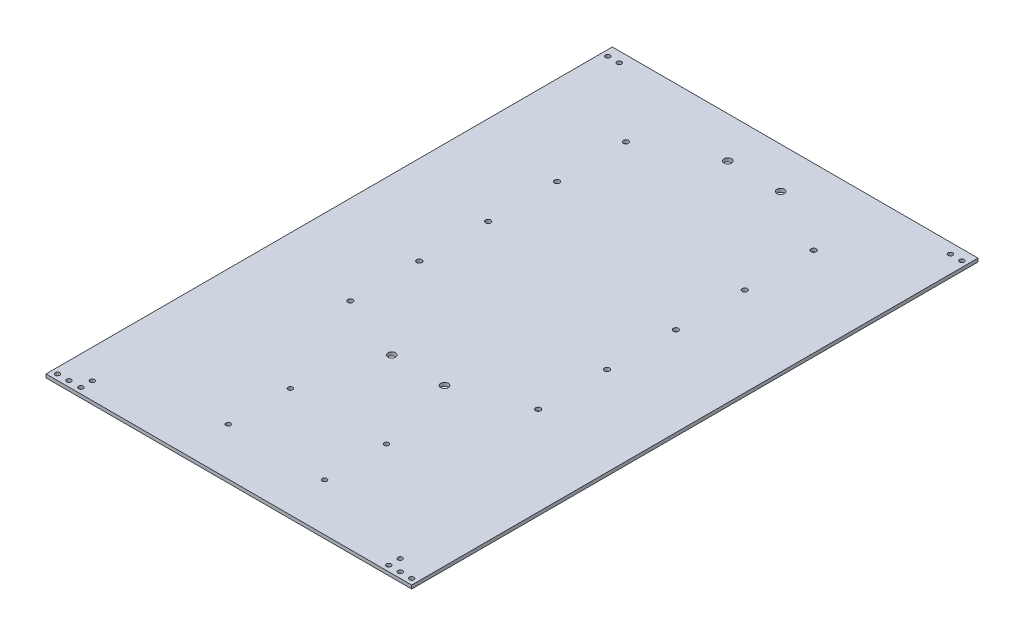
from build123d import *

# Parameters (mm, degrees)
SKETCH_1_W               = 318.56
SKETCH_1_H               = 493.33
SKETCH_1_R               = 2.25
SKETCH_1_R_2             = 2
EXTRUDE_1_DEPTH          = 3
CUT_EXTRUDE_1_DEPTH      = 294.637090002
CUT_EXTRUDE_1_DEPTH_BACK = 294.637090002
SKETCH_2_R               = 2
SKETCH_2_R_2             = 3.3


with BuildPart() as part:
    # 草图1 → 凸台-拉伸1 (new body)
    with BuildSketch(Plane(origin=(0, 0, 0), x_dir=(1, 0, 0), z_dir=(0, 1, 0))):
        Rectangle(SKETCH_1_W, SKETCH_1_H)
        with Locations((81.78, 181.012789491)):
            Circle(SKETCH_1_R, mode=Mode.SUBTRACT)
        with Locations((81.78, 121.012789491)):
            Circle(SKETCH_1_R, mode=Mode.SUBTRACT)
        with Locations((81.78, 61.012789491)):
            Circle(SKETCH_1_R, mode=Mode.SUBTRACT)
        with Locations((81.78, -58.987210509)):
            Circle(SKETCH_1_R, mode=Mode.SUBTRACT)
        with Locations((81.78, 1.012789491)):
            Circle(SKETCH_1_R, mode=Mode.SUBTRACT)
        with Locations((-81.78, -58.987210509)):
            Circle(SKETCH_1_R, mode=Mode.SUBTRACT)
        with Locations((-81.78, 1.012789491)):
            Circle(SKETCH_1_R, mode=Mode.SUBTRACT)
        with Locations((-81.78, 61.012789491)):
            Circle(SKETCH_1_R, mode=Mode.SUBTRACT)
        with Locations((-81.78, 121.012789491)):
            Circle(SKETCH_1_R, mode=Mode.SUBTRACT)
        with Locations((-81.78, 181.012789491)):
            Circle(SKETCH_1_R, mode=Mode.SUBTRACT)
        with Locations((-154.28, 237.665)):
            Circle(SKETCH_1_R_2, mode=Mode.SUBTRACT)
        with Locations((-144.28, 237.665)):
            Circle(SKETCH_1_R_2, mode=Mode.SUBTRACT)
        with Locations((144.28, 237.665)):
            Circle(SKETCH_1_R_2, mode=Mode.SUBTRACT)
        with Locations((154.28, 237.665)):
            Circle(SKETCH_1_R_2, mode=Mode.SUBTRACT)
        with Locations((134.28, -231.665)):
            Circle(SKETCH_1_R_2, mode=Mode.SUBTRACT)
        with Locations((134.28, -241.665)):
            Circle(SKETCH_1_R_2, mode=Mode.SUBTRACT)
        with Locations((144.28, -241.665)):
            Circle(SKETCH_1_R_2, mode=Mode.SUBTRACT)
        with Locations((154.28, -241.665)):
            Circle(SKETCH_1_R_2, mode=Mode.SUBTRACT)
        with Locations((-133.885842783, -231.665)):
            Circle(SKETCH_1_R_2, mode=Mode.SUBTRACT)
        with Locations((-133.885842783, -241.665)):
            Circle(SKETCH_1_R_2, mode=Mode.SUBTRACT)
        with Locations((-144.28, -241.665)):
            Circle(SKETCH_1_R_2, mode=Mode.SUBTRACT)
        with Locations((-154.28, -241.665)):
            Circle(SKETCH_1_R_2, mode=Mode.SUBTRACT)
    extrude(amount=EXTRUDE_1_DEPTH)

    # 草图2 → 切除-拉伸1 (cut, two sides: drawn at the far end of the back side and taken through both)
    with BuildSketch(Plane.XZ.offset(-CUT_EXTRUDE_1_DEPTH_BACK)):
        with Locations((41.9, 205.217949373)):
            Circle(SKETCH_2_R)
        with Locations((-41.9, 151.217949373)):
            Circle(SKETCH_2_R)
        with Locations((41.9, 151.217949373)):
            Circle(SKETCH_2_R)
        with Locations((-41.9, 205.217949373)):
            Circle(SKETCH_2_R)
        with Locations((-23, -211.012789491)):
            Circle(SKETCH_2_R_2)
        with Locations((23, -211.012789491)):
            Circle(SKETCH_2_R_2)
        with Locations((-23, 81.776091935)):
            Circle(SKETCH_2_R_2)
        with Locations((23, 81.776091935)):
            Circle(SKETCH_2_R_2)
    extrude(amount=CUT_EXTRUDE_1_DEPTH + CUT_EXTRUDE_1_DEPTH_BACK, mode=Mode.SUBTRACT)


solid = part.part
